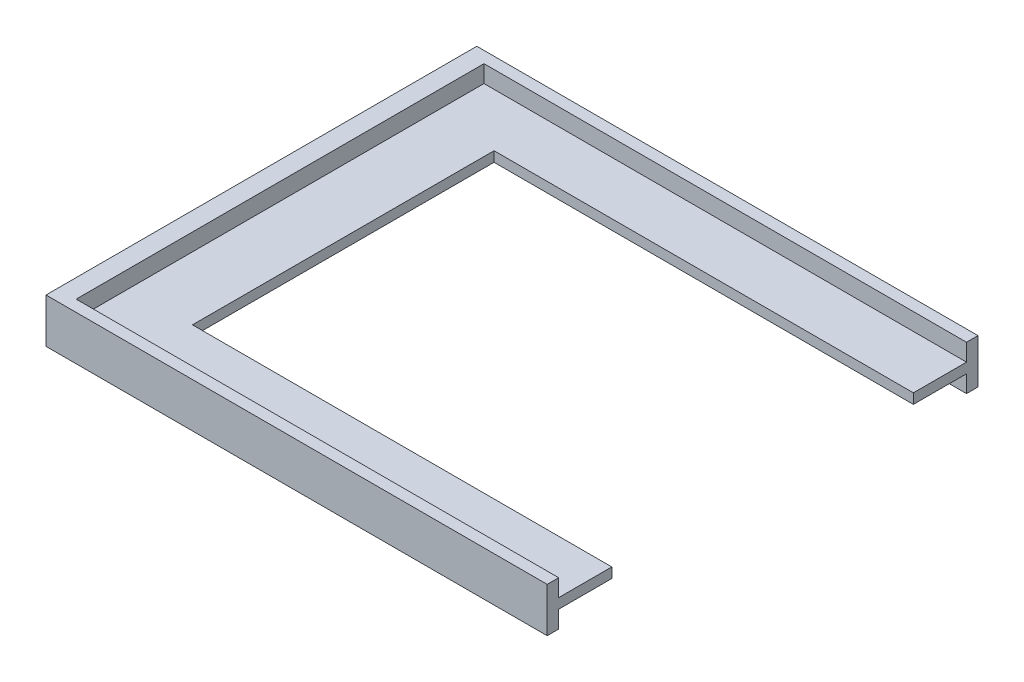
from build123d import *

# Parameters (mm, degrees)
BOSS_EXTRUDE1_DEPTH      = 1.4
BOSS_EXTRUDE2_DEPTH      = 2.4
BOSS_EXTRUDE2_DEPTH_BACK = 3.8


with BuildPart() as part:
    # Sketch1 → Boss-Extrude1 (new body)
    with BuildSketch(Plane(origin=(0, 0, 0), x_dir=(1, 0, 0), z_dir=(0, 1, 0))):
        Polygon((0, 0), (5.4, 0), (5.4, -7), (5.4, -9), (-58.4, -9), (-61.4, -9), (-64.4, -9), (-64.4, 51), (-61.4, 51), (-58.4, 51), (5.4, 51), (5.4, 49), (5.4, 42), (0, 42), (-53, 42), (-53, 0), align=None)
    extrude(amount=BOSS_EXTRUDE1_DEPTH)

    # Sketch2 → Boss-Extrude2 (add, two sides: drawn at the far end of the back side and taken through both)
    with BuildSketch(Plane(origin=(0, 1.4, 0), x_dir=(1, 0, 0), z_dir=(0, 1, 0)).offset(-BOSS_EXTRUDE2_DEPTH_BACK)):
        Polygon((-64.4, 51), (5.4, 51), (5.4, 49.4), (-61.8, 49.4), (-61.8, -7.4), (5.4, -7.4), (5.4, -9), (-64.4, -9), align=None)
    extrude(amount=BOSS_EXTRUDE2_DEPTH + BOSS_EXTRUDE2_DEPTH_BACK)


solid = part.part
